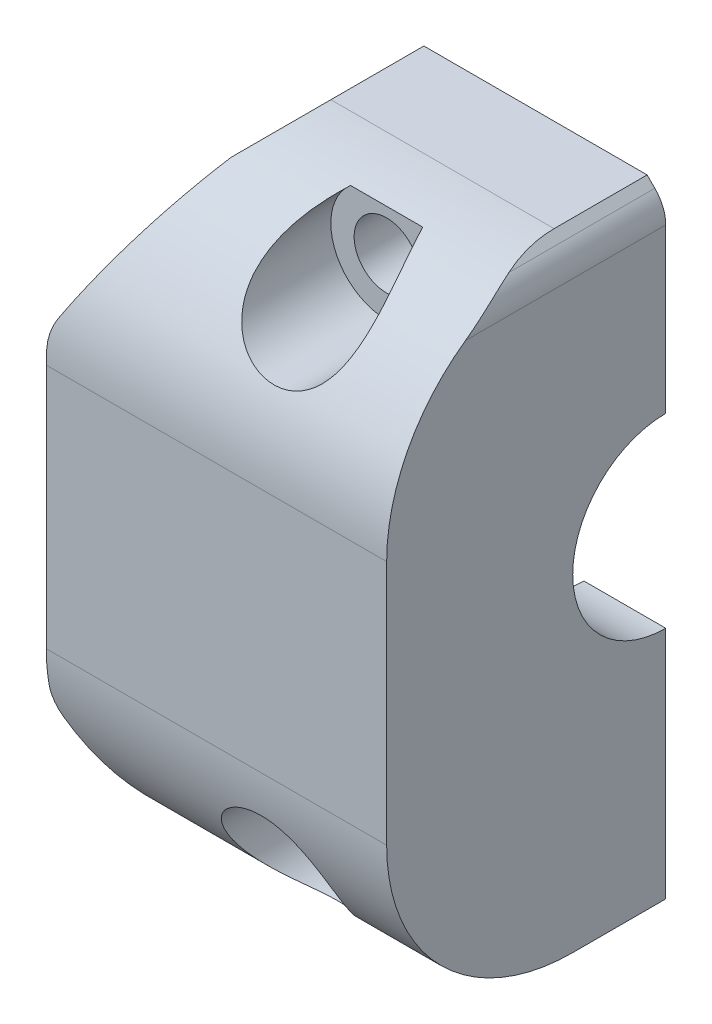
from build123d import *

# Parameters (mm, degrees)
BOSS_EXTRUDE1_DEPTH = 15
SKETCH3_R           = 5
CUT_EXTRUDE1_DEPTH  = 13
CUT_EXTRUDE2_START  = -7
SKETCH4_R           = 10.1
CUT_EXTRUDE2_DEPTH  = 2.6
SKETCH5_R           = 1.75
CUT_EXTRUDE3_DEPTH  = 131.953306572
CUT_EXTRUDE4_START  = -8
SKETCH6_R           = 3
CUT_EXTRUDE4_DEPTH  = 123.953306572
FILLET1_START       = -130
FILLET1_DEPTH       = 19.4
CUT_EXTRUDE5_DEPTH  = 8


with BuildPart() as part:
    # Sketch1 → Boss-Extrude1 (new body)
    with BuildSketch(Plane.XY):
        with BuildLine():
            Line((-124.6, 14.6), (-128.493415545, 7.856406461))
            ThreePointArc((-128.493415545, 7.856406461), (-128.793116813, 7.132863596), (-128.895339334, 6.356406461))
            Line((-128.895339334, 6.356406461), (-128.895339334, -9.356406461))
            ThreePointArc((-128.895339334, -9.356406461), (-128.793116813, -10.132863596), (-128.493415545, -10.856406461))
            Line((-128.493415545, -10.856406461), (-124.6, -17.6))
            Line((-124.6, -17.6), (-110.6, -17.6))
            Line((-110.6, -17.6), (-110.6, -5))
            Line((-110.6, -5), (-110.6, 5))
            Line((-110.6, 5), (-110.6, 13.771572875))
            ThreePointArc((-110.6, 13.771572875), (-110.752240935, 14.53693974), (-111.185786438, 15.185786438))
            Line((-111.185786438, 15.185786438), (-111.6, 15.6))
            Line((-111.6, 15.6), (-123.6, 15.6))
            Line((-123.6, 15.6), (-124.6, 14.6))
        make_face()
    extrude(amount=BOSS_EXTRUDE1_DEPTH)

    # Sketch3 → Cut-Extrude1 (cut)
    with BuildSketch(Plane(origin=(-110.6, 0, 0), x_dir=(0, 0, -1), z_dir=(1, 0, 0))):
        Circle(SKETCH3_R)
    extrude(amount=-CUT_EXTRUDE1_DEPTH, mode=Mode.SUBTRACT)

    # Sketch4 → Cut-Extrude2 (cut, symmetric)
    with BuildSketch(Plane(origin=(-110.6, 0, 0), x_dir=(0, 0, -1), z_dir=(1, 0, 0)).offset(CUT_EXTRUDE2_START)):
        Circle(SKETCH4_R)
    extrude(amount=CUT_EXTRUDE2_DEPTH, both=True, mode=Mode.SUBTRACT)

    # Sketch5 → Cut-Extrude3 (cut, through all)
    with BuildSketch(Plane(origin=(0, 0, 0), x_dir=(-1, 0, 0), z_dir=(0, 0, -1))):
        with Locations((117.6, 12.85)):
            Circle(SKETCH5_R)
        with Locations((117.6, -12.85)):
            Circle(SKETCH5_R)
    extrude(amount=-CUT_EXTRUDE3_DEPTH, mode=Mode.SUBTRACT)

    # Sketch6 → Cut-Extrude4 (cut, through all)
    with BuildSketch(Plane(origin=(0, 0, 0), x_dir=(-1, 0, 0), z_dir=(0, 0, -1)).offset(CUT_EXTRUDE4_START)):
        with Locations((117.6, 12.85)):
            Circle(SKETCH6_R)
        with Locations((117.6, -12.85)):
            Circle(SKETCH6_R)
    extrude(amount=-CUT_EXTRUDE4_DEPTH, mode=Mode.SUBTRACT)

    # Fillet1: read off the stored shape, not the designer's step
    # Fillet1 outline → Fillet1 (cut)
    with BuildSketch(Plane.YZ.offset(FILLET1_START)):
        with BuildLine():
            ThreePointArc((-17.6, 5), (-14.671067812, 12.071067812), (-7.6, 15))
            Line((-7.6, 15), (-17.6, 15))
            Line((-17.6, 15), (-17.6, 5))
        make_face()
        with BuildLine():
            ThreePointArc((5.6, 15), (12.671067812, 12.071067812), (15.6, 5))
            Line((15.6, 5), (15.6, 15))
            Line((15.6, 15), (5.6, 15))
        make_face()
    extrude(amount=FILLET1_DEPTH, mode=Mode.SUBTRACT)

    # Sketch7 → Cut-Extrude5 (cut)
    with BuildSketch(Plane(origin=(0, 0, 0), x_dir=(-1, 0, 0), z_dir=(0, 0, -1))):
        Polygon((115, -8.6), (124.2, -8.6), (126.2, -6.6), (126.2, 6.6), (124.2, 8.6), (115, 8.6), align=None)
    extrude(amount=-CUT_EXTRUDE5_DEPTH, mode=Mode.SUBTRACT)


solid = part.part
